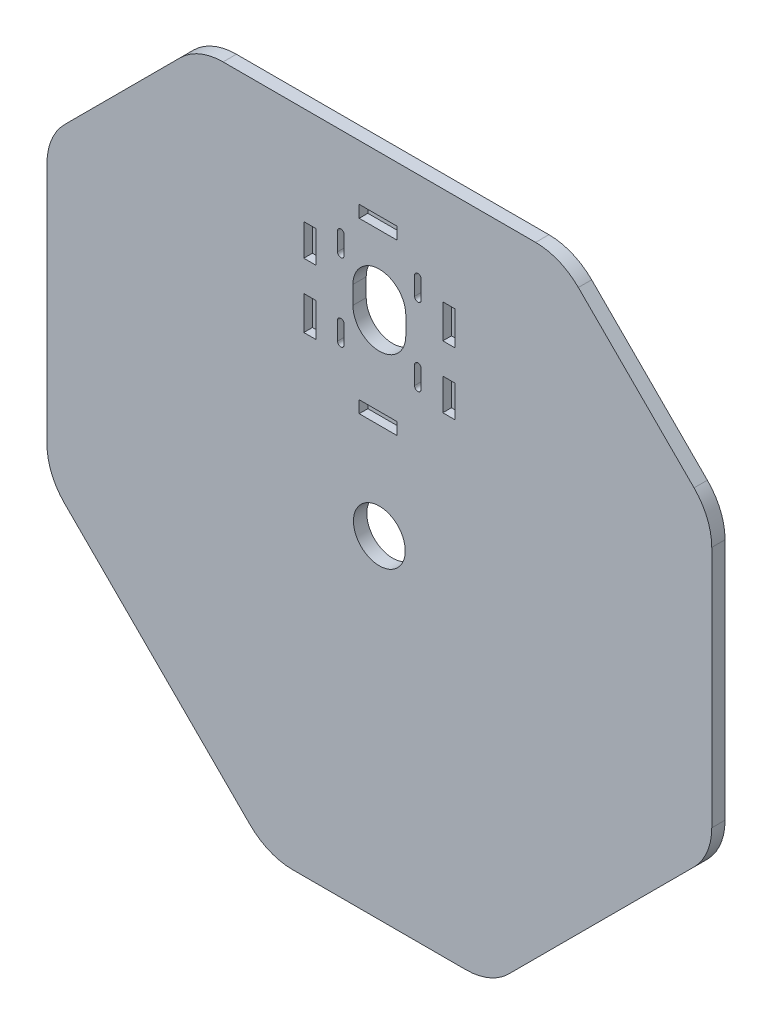
from build123d import *

# Parameters (mm, degrees)
BOSS_EXTRUDE1_DEPTH = 5.588
CUT_EXTRUDE1_DEPTH  = 260.036579176
CUT_EXTRUDE2_DEPTH  = 260.036579176
CUT_EXTRUDE3_DEPTH  = 260.036579176
CAVITY1_START       = 1.9558
CAVITY1_OUTLINE_W   = 15.946260678
CAVITY1_OUTLINE_H   = 5.08
CAVITY1_OUTLINE_W_2 = 5.08
CAVITY1_OUTLINE_H_2 = 14.202900977
CAVITY1_OUTLINE_H_3 = 13.341513611
CAVITY1_DEPTH       = 3.6322
CAVITY2_OUTLINE_R   = 10.875645
CAVITY2_DEPTH       = 5.588


# Read off the part's stored shape, not the designer's step: Cavity1, Cavity2
with BuildPart() as part:
    # Sketch1 → Boss-Extrude1 (new body)
    with BuildSketch(Plane.XY):
        with BuildLine():
            Line((65.678975516, 61.334336478), (-65.678975516, 61.334336478))
            ThreePointArc((-65.678975516, 61.334336478), (-75.399134698, 59.400876604), (-83.639487758, 53.89484872))
            Line((-83.639487758, 53.89484872), (-132.260512242, 5.273824236))
            ThreePointArc((-132.260512242, 5.273824236), (-137.766540126, -2.966528824), (-139.7, -12.686688006))
            Line((-139.7, -12.686688006), (-139.7, -114.753454114))
            ThreePointArc((-139.7, -114.753454114), (-137.766540126, -124.473613296), (-132.260512242, -132.713966356))
            Line((-132.260512242, -132.713966356), (-54.348302834, -210.626175764))
            ThreePointArc((-54.348302834, -210.626175764), (-46.107949774, -216.132203648), (-36.387790592, -218.065663522))
            Line((-36.387790592, -218.065663522), (36.387790592, -218.065663522))
            ThreePointArc((36.387790592, -218.065663522), (46.107949774, -216.132203648), (54.348302834, -210.626175764))
            Line((54.348302834, -210.626175764), (132.260512242, -132.713966356))
            ThreePointArc((132.260512242, -132.713966356), (137.766540126, -124.473613296), (139.7, -114.753454114))
            Line((139.7, -114.753454114), (139.7, -12.686688006))
            ThreePointArc((139.7, -12.686688006), (137.766540126, -2.966528824), (132.260512242, 5.273824236))
            Line((132.260512242, 5.273824236), (83.639487758, 53.89484872))
            ThreePointArc((83.639487758, 53.89484872), (75.399134698, 59.400876604), (65.678975516, 61.334336478))
        make_face()
    extrude(amount=BOSS_EXTRUDE1_DEPTH)

    # Sketch3 → Cut-Extrude1 (cut, through all)
    with BuildSketch(Plane(origin=(0, 0, 0), x_dir=(-1, 0, 0), z_dir=(0, 0, -1))):
        with BuildLine():
            Line((-17.5895, 16.256), (-17.5895, 23.876))
            ThreePointArc((-17.5895, 23.876), (-16.1925, 25.273), (-14.7955, 23.876))
            Line((-14.7955, 23.876), (-14.7955, 16.256))
            ThreePointArc((-14.7955, 16.256), (-16.1925, 14.859), (-17.5895, 16.256))
        make_face()
        with BuildLine():
            Line((14.7955, 16.256), (14.7955, 23.876))
            ThreePointArc((14.7955, 23.876), (16.1925, 25.273), (17.5895, 23.876))
            Line((17.5895, 23.876), (17.5895, 16.256))
            ThreePointArc((17.5895, 16.256), (16.1925, 14.859), (14.7955, 16.256))
        make_face()
        with BuildLine():
            Line((-17.5895, -16.256), (-17.5895, -8.636))
            ThreePointArc((-17.5895, -8.636), (-16.1925, -7.239), (-14.7955, -8.636))
            Line((-14.7955, -8.636), (-14.7955, -16.256))
            ThreePointArc((-14.7955, -16.256), (-16.1925, -17.653), (-17.5895, -16.256))
        make_face()
    extrude(amount=-CUT_EXTRUDE1_DEPTH, mode=Mode.SUBTRACT)

    # Sketch6 → Cut-Extrude2 (cut, through all)
    with BuildSketch(Plane(origin=(0, 0, 0), x_dir=(-1, 0, 0), z_dir=(0, 0, -1))):
        with BuildLine():
            Line((-11.1125, 0), (-11.1125, 7.62))
            ThreePointArc((-11.1125, 7.62), (0, 18.7325), (11.1125, 7.62))
            Line((11.1125, 7.62), (11.1125, 0))
            ThreePointArc((11.1125, 0), (0, -11.1125), (-11.1125, 0))
        make_face()
    extrude(amount=-CUT_EXTRUDE2_DEPTH, mode=Mode.SUBTRACT)

    # Sketch5 → Cut-Extrude3 (cut, through all)
    with BuildSketch(Plane(origin=(0, 0, 0), x_dir=(-1, 0, 0), z_dir=(0, 0, -1))):
        with BuildLine():
            Line((14.7955, -16.256), (14.7955, -8.636))
            ThreePointArc((14.7955, -8.636), (16.1925, -7.239), (17.5895, -8.636))
            Line((17.5895, -8.636), (17.5895, -16.256))
            ThreePointArc((17.5895, -16.256), (16.1925, -17.653), (14.7955, -16.256))
        make_face()
    extrude(amount=-CUT_EXTRUDE3_DEPTH, mode=Mode.SUBTRACT)

    # Cavity1 outline → Cavity1 (cut)
    with BuildSketch(Plane.XY.offset(CAVITY1_START)):
        with Locations((-0.487430597, 35.56)):
            Rectangle(CAVITY1_OUTLINE_W, CAVITY1_OUTLINE_H)
        with Locations((-0.487430597, -35.56)):
            Rectangle(CAVITY1_OUTLINE_W, CAVITY1_OUTLINE_H)
        with Locations((29.21, 13.086687708)):
            Rectangle(CAVITY1_OUTLINE_W_2, CAVITY1_OUTLINE_H_2)
        with Locations((-29.21, 13.517381391)):
            Rectangle(CAVITY1_OUTLINE_W_2, CAVITY1_OUTLINE_H_3)
        with Locations((29.21, -13.517381391)):
            Rectangle(CAVITY1_OUTLINE_W_2, CAVITY1_OUTLINE_H_3)
        with Locations((-29.21, -13.086687708)):
            Rectangle(CAVITY1_OUTLINE_W_2, CAVITY1_OUTLINE_H_2)
    extrude(amount=CAVITY1_DEPTH, mode=Mode.SUBTRACT)

    # Cavity2 outline → Cavity2 (cut)
    with BuildSketch(Plane.XY):
        with Locations((0, -78.365663522)):
            Circle(CAVITY2_OUTLINE_R)
    extrude(amount=CAVITY2_DEPTH, mode=Mode.SUBTRACT)


solid = part.part
